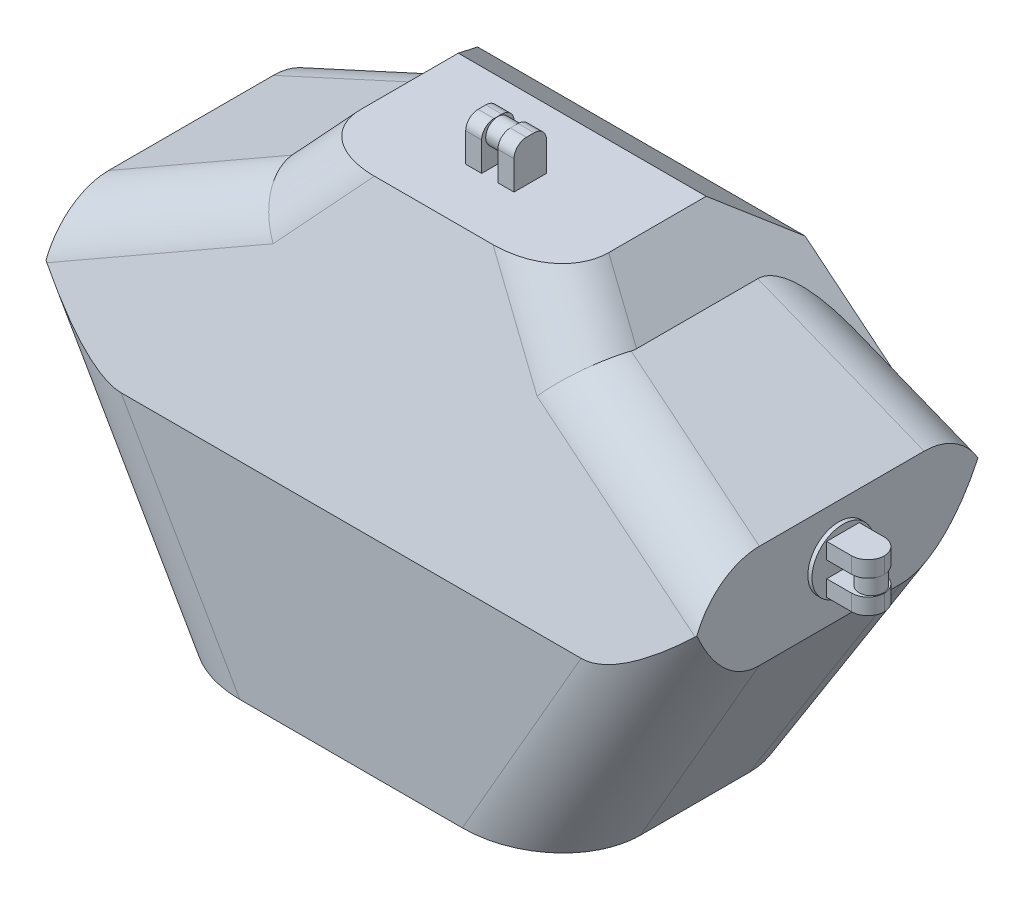
from build123d import *

# Parameters (mm, degrees)
SKETCH1_W                   = 400.05
SKETCH1_H                   = 190.5
EXTRUDE1_DEPTH              = 269.108
SKETCH7_OUTSIDE_W           = 296.182
SKETCH7_OUTSIDE_H           = 374.79
CUT_EXTRUDE1_DEPTH          = 431.8
SKETCH8_OUTSIDE_W           = 505.732
SKETCH8_OUTSIDE_H           = 374.79
CUT_EXTRUDE2_DEPTH          = 431.8
FILLET1_R                   = 50.8
FILLET10_R                  = 38.1
SKETCH9_W                   = 9.7930423
SKETCH9_H                   = 20
SKETCH9_W_2                 = 9.906
BOSS_EXTRUDE1_DEPTH         = 25.4
SKETCH11_R                  = 7.5
BOSS_EXTRUDE3_DEPTH         = 29.6990423
FILLET11_R                  = 7.62
FILLET11_OF_MIRROR1_R       = 7.62
SKETCH12_R                  = 19.05
BOSS_EXTRUDE6_DEPTH         = 2.54
SKETCH14_W                  = 20
SKETCH14_H                  = 9.906
BOSS_EXTRUDE7_DEPTH         = 25.4
BOSS_EXTRUDE8_DEPTH         = 29.812
FILLET15_R                  = 10.1346
BODY_MOVE_COPY1_START       = 144.930148569
BODY_MOVE_COPY1_OUTLINE_R   = 7.5
BODY_MOVE_COPY1_DEPTH       = 29.812
BODY_MOVE_COPY1_2_OUTLINE_R = 7.5
BODY_MOVE_COPY1_2_DEPTH     = 9.906
BODY_MOVE_COPY1_START_2     = 164.836148569
BODY_MOVE_COPY1_3_OUTLINE_R = 7.5
BODY_MOVE_COPY1_3_DEPTH     = 9.906
BODY_MOVE_COPY1_START_3     = 197.485
BODY_MOVE_COPY1_4_OUTLINE_R = 19.05
BODY_MOVE_COPY1_4_DEPTH     = 5.08
CUT_EXTRUDE3_START          = -2.54
SKETCH16_R                  = 19.05
CUT_EXTRUDE3_DEPTH          = 2.54


with BuildPart() as part:
    # Sketch1 → Extrude1 (new body)
    with BuildSketch(Plane(origin=(0, 0, 0), x_dir=(1, 0, 0), z_dir=(0, 1, 0))):
        Rectangle(SKETCH1_W, SKETCH1_H)
    extrude(amount=EXTRUDE1_DEPTH)

    # Sketch7 outside → Cut-Extrude1 (cut)
    with BuildSketch(Plane.ZY.offset(200.025)):
        with Locations((0, 134.554)):
            Rectangle(SKETCH7_OUTSIDE_W, SKETCH7_OUTSIDE_H)
        Polygon((44.432087016, 269.108), (95.25, 126.795116664), (95.25, 0), (-69.85, 0), (-95.25, 157.93380788), (-83.14873838, 242.038278884), (-46.830898628, 269.108), align=None, mode=Mode.SUBTRACT)
    extrude(amount=-CUT_EXTRUDE1_DEPTH, mode=Mode.SUBTRACT)

    # Sketch8 outside → Cut-Extrude2 (cut)
    with BuildSketch(Plane.XY.offset(95.25)):
        with Locations((0, 134.554)):
            Rectangle(SKETCH8_OUTSIDE_W, SKETCH8_OUTSIDE_H)
        Polygon((127, 0), (200.025, 126.795116664), (200.025, 190.295116664), (104.551859803, 237.732642625), (76.2, 269.108), (-76.2, 269.108), (-104.551859803, 237.732642625), (-200.025, 190.295116664), (-200.025, 126.795116664), (-127, 0), align=None, mode=Mode.SUBTRACT)
    extrude(amount=-CUT_EXTRUDE2_DEPTH, mode=Mode.SUBTRACT)

    # Fillet1
    fillet1_edges = [part.edges().sort_by_distance(p)[0] for p in [
        (-163.5125, 63.397558332, 95.25),
        (-163.5125, 63.397558332, -80.046030877),
        (163.5125, 63.397558332, -80.046030877),
        (163.5125, 63.397558332, 95.25),
    ]]
    fillet(fillet1_edges, radius=FILLET1_R)

    # Fillet10
    fillet10_edges = [part.edges().sort_by_distance(p)[0] for p in [
        (152.288429902, 214.013879644, -87.180992348),
        (152.288429902, 214.013879644, 64.105416293),
        (-152.288429902, 214.013879644, -87.180992348),
        (-152.288429902, 214.013879644, 64.105416293),
        (90.375929902, 253.420321312, 50.033934662),
        (-90.375929902, 253.420321312, 50.033934662),
    ]]
    fillet(fillet10_edges, radius=FILLET10_R)

    # Sketch9 → Boss-Extrude1 (add)
    with BuildSketch(Plane(origin=(0, 269.108, 0), x_dir=(1, 0, 0), z_dir=(0, 1, 0))):
        with Locations((-9.89652115, 0)):
            Rectangle(SKETCH9_W, SKETCH9_H)
        with Locations((9.953, 0)):
            Rectangle(SKETCH9_W_2, SKETCH9_H)
    boss_extrude1 = extrude(amount=BOSS_EXTRUDE1_DEPTH)

    # Sketch11 → Boss-Extrude3 (add)
    with BuildSketch(Plane(origin=(14.906, 0, 0), x_dir=(0, 0, -1), z_dir=(1, 0, 0))):
        with Locations((0, 286.886577907)):
            Circle(SKETCH11_R)
    boss_extrude3 = extrude(amount=-BOSS_EXTRUDE3_DEPTH)

    # Fillet11
    fillet11_edges = [part.edges().sort_by_distance(p)[0] for p in [
        (-9.89652115, 294.508, 10),
        (-9.89652115, 294.508, -10),
        (9.953, 294.508, -10),
        (9.953, 294.508, 10),
    ]]
    fillet(fillet11_edges, radius=FILLET11_R)

    # Mirror1: Boss-Extrude1, Boss-Extrude3 across plane
    add(boss_extrude1.mirror(Plane.ZX.offset(135.758)))
    add(boss_extrude3.mirror(Plane.ZX.offset(135.758)))

    # Fillet11 of Mirror1
    fillet11_of_mirror1_edges = [part.edges().sort_by_distance(p)[0] for p in [
        (-9.89652115, -22.992, 10),
        (-9.89652115, -22.992, -10),
        (9.953, -22.992, -10),
        (9.953, -22.992, 10),
    ]]
    fillet(fillet11_of_mirror1_edges, radius=FILLET11_OF_MIRROR1_R)


with BuildPart() as body_2:
    # Sketch12 → Boss-Extrude6 (new, symmetric)
    with BuildSketch(Plane(origin=(200.025, 0, 0), x_dir=(0, 0, -1), z_dir=(1, 0, 0))):
        with Locations((4.538473093, 159.836148569)):
            Circle(SKETCH12_R)
    extrude(amount=BOSS_EXTRUDE6_DEPTH, both=True)

    # Sketch14 → Boss-Extrude7 (add)
    with BuildSketch(Plane(origin=(202.565, 0, 0), x_dir=(0, 0, -1), z_dir=(1, 0, 0))):
        with Locations((4.538473093, 169.789148569)):
            Rectangle(SKETCH14_W, SKETCH14_H)
        with Locations((4.538473093, 149.883148569)):
            Rectangle(SKETCH14_W, SKETCH14_H)
    extrude(amount=BOSS_EXTRUDE7_DEPTH)

    # Sketch15 → Boss-Extrude8 (add)
    with BuildSketch(Plane.XZ.offset(-144.930148569)):
        with BuildLine():
            ThreePointArc((212.493733331, -4.538473093), (219.993733331, -12.038473093), (227.493733331, -4.538473093))
            Line((227.493733331, -4.538473093), (212.493733331, -4.538473093))
        make_face()
        with BuildLine():
            Line((212.493733331, -4.538473093), (227.493733331, -4.538473093))
            ThreePointArc((227.493733331, -4.538473093), (219.993733331, 2.961526907), (212.493733331, -4.538473093))
        make_face()
    extrude(amount=-BOSS_EXTRUDE8_DEPTH)

    # Fillet15
    # the kernel refuses this fillet: 10.1346 mm, written as the material it takes off along each edge
    with BuildSketch(Plane(origin=(227.965, 200.078648569, 5.461526907), x_dir=(-1, 0, 0), z_dir=(0, -1, 0)), Plane(origin=(227.965, 139.499648569, -14.538473093), x_dir=(-1, 0, 0), z_dir=(0, 1, 0))) as fillet15_piece_1:
        with BuildLine():
            CenterArc((FILLET15_R, FILLET15_R), FILLET15_R, 180, 90)
            Line((0, FILLET15_R), (0, 0))
            Line((0, 0), (FILLET15_R, 0))
        make_face()
    extrude(amount=60.579, mode=Mode.SUBTRACT)
    with BuildSketch(Plane(origin=(227.965, 119.593648569, 5.461526907), x_dir=(-1, 0, 0), z_dir=(0, 1, 0)), Plane(origin=(227.965, 180.172648569, -14.538473093), x_dir=(-1, 0, 0), z_dir=(0, -1, 0))) as fillet15_piece_2:
        with BuildLine():
            CenterArc((FILLET15_R, -FILLET15_R), FILLET15_R, 90, 90)
            Line((0, -FILLET15_R), (0, 0))
            Line((0, 0), (FILLET15_R, 0))
        make_face()
    extrude(amount=60.579, mode=Mode.SUBTRACT)


with BuildPart() as body_3:
    # Body-Move/Copy1: read off the stored shape, not the designer's step
    # Body-Move/Copy1 outline → Body-Move/Copy1 (new body)
    with BuildSketch(Plane(origin=(0, 0, 0), x_dir=(1, 0, 0), z_dir=(0, 1, 0)).offset(BODY_MOVE_COPY1_START)):
        with Locations((219.993733331, 4.538473093)):
            Circle(BODY_MOVE_COPY1_OUTLINE_R)
    extrude(amount=BODY_MOVE_COPY1_DEPTH)

    # Body-Move_Copy1 2 outline → Body-Move_Copy1 2 (add)
    with BuildSketch(Plane(origin=(0, 0, 0), x_dir=(1, 0, 0), z_dir=(0, 1, 0)).offset(BODY_MOVE_COPY1_START)):
        with BuildLine():
            Line((202.565, 14.538473093), (202.565, -5.461526907))
            Line((202.565, -5.461526907), (217.8304, -5.461526907))
            ThreePointArc((217.8304, -5.461526907), (224.948897032, -2.54060261), (227.964106133, 4.538473093))
            ThreePointArc((227.964106133, 4.538473093), (224.948897032, 11.617548797), (217.8304, 14.538473093))
            Line((217.8304, 14.538473093), (202.565, 14.538473093))
        make_face()
        with Locations((219.993733331, 4.538473093)):
            Circle(BODY_MOVE_COPY1_2_OUTLINE_R, mode=Mode.SUBTRACT)
    extrude(amount=BODY_MOVE_COPY1_2_DEPTH)

    # Body-Move_Copy1 3 outline → Body-Move_Copy1 3 (add)
    with BuildSketch(Plane(origin=(0, 0, 0), x_dir=(1, 0, 0), z_dir=(0, 1, 0)).offset(BODY_MOVE_COPY1_START_2)):
        with BuildLine():
            Line((202.565, 14.538473093), (202.565, -5.461526907))
            Line((202.565, -5.461526907), (217.8304, -5.461526907))
            ThreePointArc((217.8304, -5.461526907), (224.948897032, -2.54060261), (227.964106133, 4.538473093))
            ThreePointArc((227.964106133, 4.538473093), (224.948897032, 11.617548797), (217.8304, 14.538473093))
            Line((217.8304, 14.538473093), (202.565, 14.538473093))
        make_face()
        with Locations((219.993733331, 4.538473093)):
            Circle(BODY_MOVE_COPY1_3_OUTLINE_R, mode=Mode.SUBTRACT)
    extrude(amount=BODY_MOVE_COPY1_3_DEPTH)

    # Body-Move_Copy1 4 outline → Body-Move_Copy1 4 (add)
    with BuildSketch(Plane.YZ.offset(BODY_MOVE_COPY1_START_3)):
        with Locations((159.836148569, -4.538473093)):
            Circle(BODY_MOVE_COPY1_4_OUTLINE_R)
    extrude(amount=BODY_MOVE_COPY1_4_DEPTH)


with BuildPart() as part_1:
    add(part.part)

    # Combine1: cut body 2
    add(body_2.part, mode=Mode.SUBTRACT)

    # Sketch16 → Cut-Extrude3 (cut)
    with BuildSketch(Plane.ZY.offset(200.025).offset(CUT_EXTRUDE3_START)):
        with Locations((-4.538473093, 159.836148569)):
            Circle(SKETCH16_R)
    extrude(amount=CUT_EXTRUDE3_DEPTH, mode=Mode.SUBTRACT)


solid = Compound([body_3.part, part_1.part])
